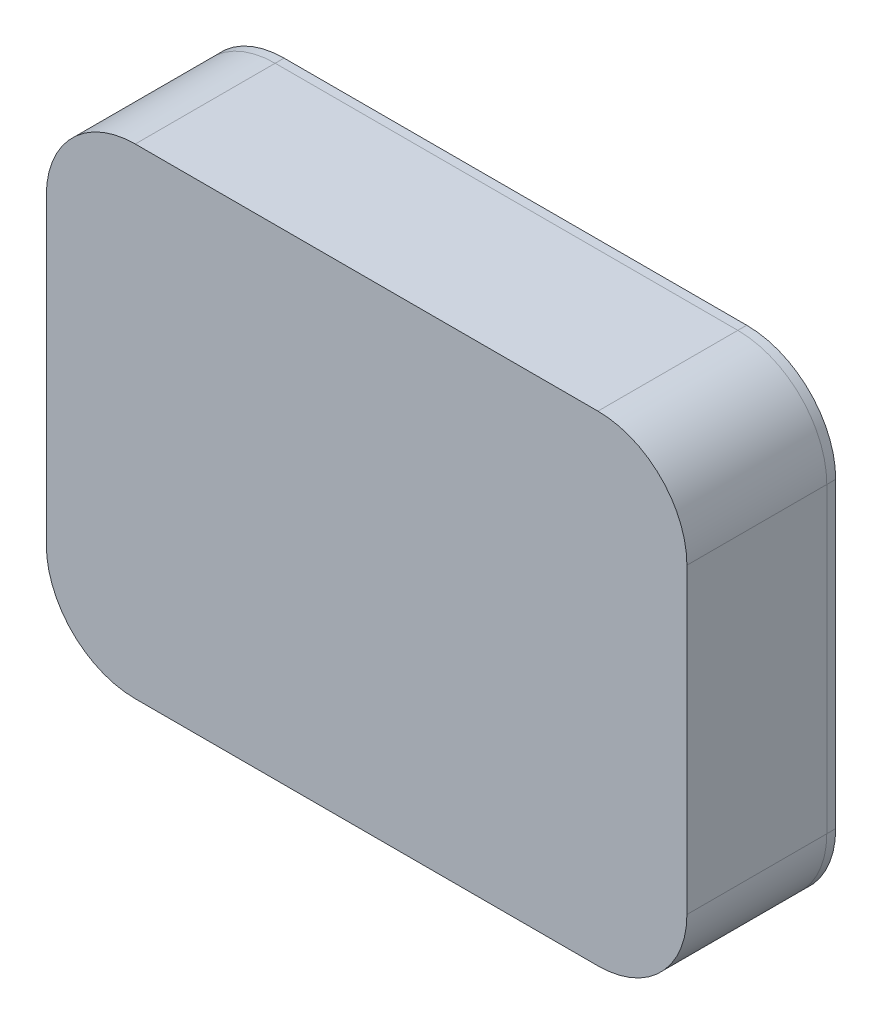
from build123d import *

# Parameters (mm, degrees)
BOSS_EXTRU_1_DEPTH      = 1.6
ESQUISSE3_R             = 0.75
ENL_V_MAT_EXTRU_1_DEPTH = 3


with BuildPart() as part:
    # Balayage1: sweep along a path in Esquisse1
    with BuildLine(Plane.XY) as balayage1_path:
        Line((-26, 27), (26, 27))
        ThreePointArc((26, 27), (33.071067812, 24.071067812), (36, 17))
        Line((36, 17), (36, -17))
        ThreePointArc((36, -17), (33.071067812, -24.071067812), (26, -27))
        Line((26, -27), (-26, -27))
        ThreePointArc((-26, -27), (-33.071067812, -24.071067812), (-36, -17))
        Line((-36, -17), (-36, 17))
        ThreePointArc((-36, 17), (-33.071067812, 24.071067812), (-26, 27))
    # profil → Balayage1 (sweep)
    with BuildSketch(Plane(origin=(0, 0, 0), x_dir=(0, 0, -1), z_dir=(1, 0, 0))):
        with BuildLine():
            Line((0, -25.5), (5.297182453, -25.5))
            Line((5.297182453, -25.5), (14.1228, -21))
            Line((14.1228, -21), (15.1228, -21))
            Line((15.1228, -21), (15.1228, -22.5))
            Line((15.1228, -22.5), (14.1228, -22.5))
            ThreePointArc((14.1228, -22.5), (12.6228, -24), (14.1228, -25.5))
            Line((14.1228, -25.5), (15.1228, -25.5))
            Line((15.1228, -25.5), (15.1228, -27))
            Line((15.1228, -27), (14.1228, -27))
            Line((14.1228, -27), (0, -27))
            Line((0, -27), (0, -25.5))
        make_face()
    sweep(path=balayage1_path.line)

    # Esquisse1<3> → Boss.-Extru.1 (add)
    with BuildSketch(Plane.XY):
        with BuildLine():
            Line((-26, 27), (26, 27))
            ThreePointArc((26, 27), (33.071067812, 24.071067812), (36, 17))
            Line((36, 17), (36, -17))
            ThreePointArc((36, -17), (33.071067812, -24.071067812), (26, -27))
            Line((26, -27), (-26, -27))
            ThreePointArc((-26, -27), (-33.071067812, -24.071067812), (-36, -17))
            Line((-36, -17), (-36, 17))
            ThreePointArc((-36, 17), (-33.071067812, 24.071067812), (-26, 27))
        make_face()
    extrude(amount=BOSS_EXTRU_1_DEPTH)

    # Esquisse3 → Enlèv. mat.-Extru.1 (cut)
    with BuildSketch(Plane(origin=(0, 0, -5), x_dir=(-1, 0, 0), z_dir=(0, 0, -1))):
        with Locations((19.633853225, -17.081435711)):
            Circle(ESQUISSE3_R)
        with Locations((-26.66614677, 17.81856429)):
            Circle(ESQUISSE3_R)
    extrude(amount=-ENL_V_MAT_EXTRU_1_DEPTH, mode=Mode.SUBTRACT)


solid = part.part
